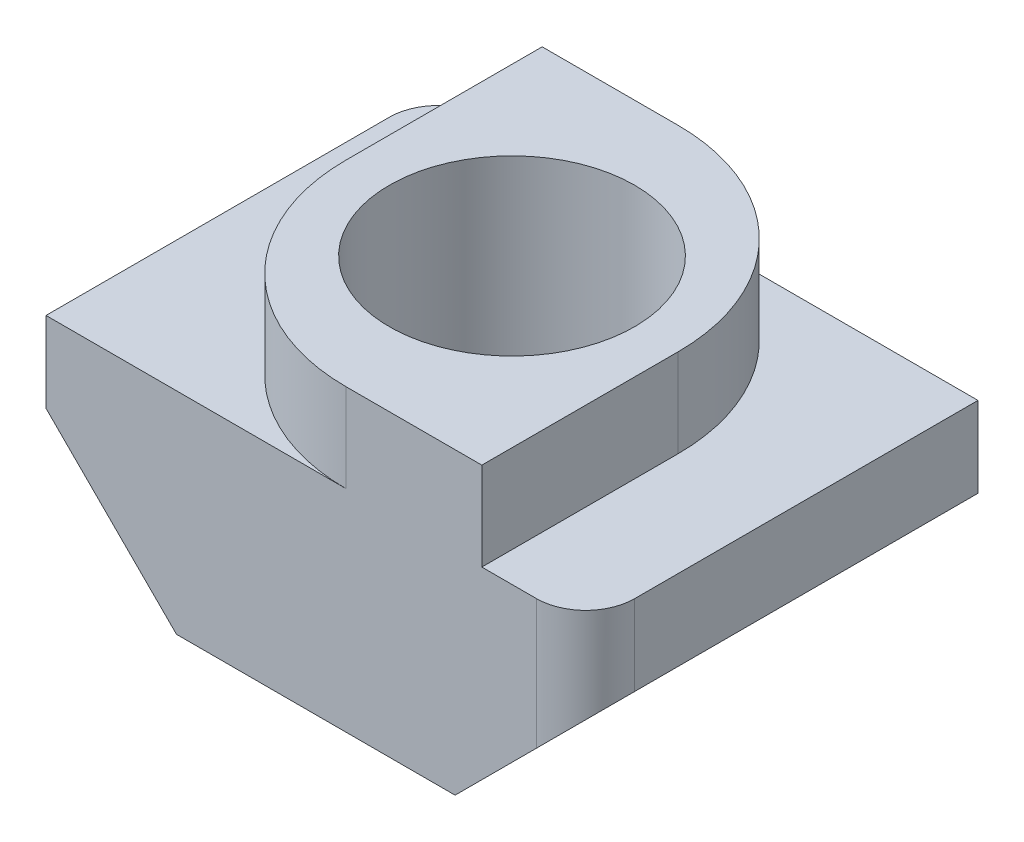
from build123d import *

# Parameters (mm, degrees)
SKETCH1_W           = 11
SKETCH1_H           = 8
SKETCH1_R           = 2.5
BOSS_EXTRUDE1_DEPTH = 4.3
CUT_EXTRUDE1_DEPTH  = 11.617909399
SKETCH3_W           = 6.77
SKETCH3_H           = 8
SKETCH3_R           = 2.5
BOSS_EXTRUDE2_DEPTH = 1.8
FILLET1_R           = 4
FILLET2_R           = 1


with BuildPart() as part:
    # Sketch1 → Boss-Extrude1 (new body)
    with BuildSketch(Plane(origin=(0, 0, 0), x_dir=(1, 0, 0), z_dir=(0, 1, 0))):
        Rectangle(SKETCH1_W, SKETCH1_H)
        Circle(SKETCH1_R, mode=Mode.SUBTRACT)
    extrude(amount=BOSS_EXTRUDE1_DEPTH)

    # Sketch2 → Cut-Extrude1 (cut, through all)
    with BuildSketch(Plane.XY.offset(4)):
        Polygon((-5.5, 2.66), (-2.84, 0), (-5.5, 0), align=None)
        Polygon((5.5, 2.66), (5.5, 0), (2.84, 0), align=None)
    extrude(amount=-CUT_EXTRUDE1_DEPTH, mode=Mode.SUBTRACT)

    # Sketch3 → Boss-Extrude2 (add)
    with BuildSketch(Plane(origin=(0, 4.3, 0), x_dir=(1, 0, 0), z_dir=(0, 1, 0))):
        Rectangle(SKETCH3_W, SKETCH3_H)
        Circle(SKETCH3_R, mode=Mode.SUBTRACT)
    extrude(amount=BOSS_EXTRUDE2_DEPTH)

    # Fillet1
    fillet1_edges = [part.edges().sort_by_distance(p)[0] for p in [
        (3.385, 5.2, -4),
        (-3.385, 5.2, 4),
    ]]
    fillet(fillet1_edges, radius=FILLET1_R)

    # Fillet2
    fillet2_edges = [part.edges().sort_by_distance(p)[0] for p in [
        (5.5, 3.48, 4),
        (-5.5, 3.48, -4),
    ]]
    fillet(fillet2_edges, radius=FILLET2_R)


solid = part.part
